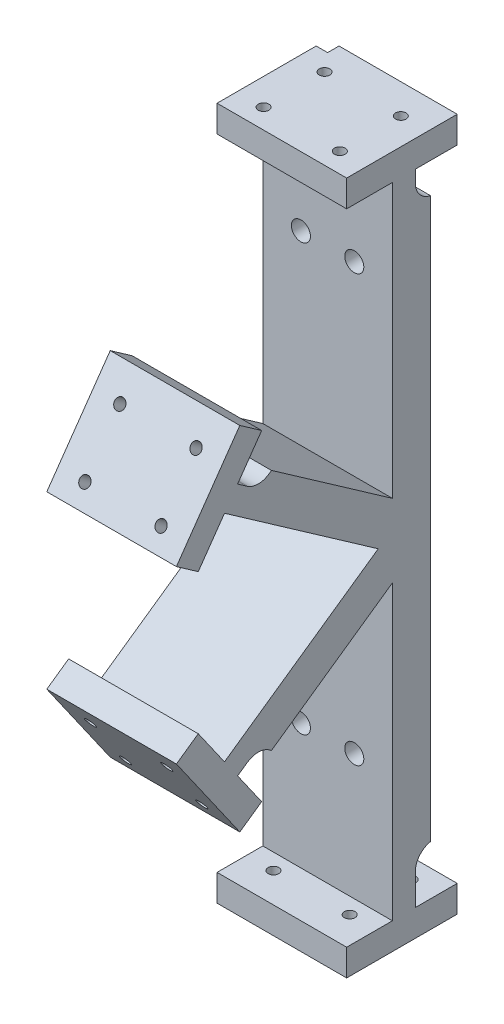
from build123d import *

# Parameters (mm, degrees)
SKETCH2_W           = 147.5
SKETCH2_H           = 176.75
BOSS_EXTRUDE1_DEPTH = 10
SKETCH3_W           = 29
SKETCH3_H           = 15
BOSS_EXTRUDE2_DEPTH = 34
BOSS_EXTRUDE3_DEPTH = 34
SKETCH8_W           = 113.5
SKETCH8_H           = 176.75
CUT_EXTRUDE1_DEPTH  = 30
SKETCH9_R           = 2.5
CUT_EXTRUDE2_DEPTH  = 134.016415209
SKETCH10_W          = 3
SKETCH10_H          = 3
CUT_EXTRUDE3_DEPTH  = 3
SKETCH11_R          = 1.4
CUT_EXTRUDE4_DEPTH  = 10
SKETCH12_R          = 1.4
CUT_EXTRUDE5_DEPTH  = 10
SKETCH13_R          = 1.4
CUT_EXTRUDE6_DEPTH  = 10
SKETCH14_R          = 1.4
CUT_EXTRUDE7_DEPTH  = 10
SKETCH15_W          = 11
SKETCH15_H          = 8
SKETCH15_W_2        = 12
CUT_EXTRUDE8_DEPTH  = 116.802867905
CUT_EXTRUDE9_DEPTH  = 116.802867905
FILLET1_R           = 5
BOSS_EXTRUDE4_START = 5
SKETCH17_W          = 34
SKETCH17_H          = 29
SKETCH17_R          = 1.4
BOSS_EXTRUDE4_DEPTH = 5
SKETCH18_W          = 11
SKETCH18_H          = 5
SKETCH18_W_2        = 12
CUT_EXTRUDE10_DEPTH = 120.662250585


with BuildPart() as part:
    # Sketch2 → Boss-Extrude1 (new body)
    with BuildSketch(Plane.XY):
        Rectangle(SKETCH2_W, SKETCH2_H)
    extrude(amount=BOSS_EXTRUDE1_DEPTH)

    # Sketch3 → Boss-Extrude2 (add)
    with BuildSketch(Plane.ZY.offset(73.75)):
        with Locations((7.5, 80.875)):
            Rectangle(SKETCH3_W, SKETCH3_H)
        with Locations((7.5, -80.875)):
            Rectangle(SKETCH3_W, SKETCH3_H)
    boss_extrude2 = extrude(amount=-BOSS_EXTRUDE2_DEPTH)

    # Mirror1: Boss-Extrude2 across plane
    add(boss_extrude2.mirror(Plane(origin=(0, 0, 0), x_dir=(0, 0, 1), z_dir=(1, 0, 0))))

    # Sketch5 → Boss-Extrude3 (add)
    with BuildSketch(Plane.ZY.offset(73.75)):
        Polygon((13.717233978, 0), (47.494362324, 23.650999887), (54.37727956, 13.821175356), (66.664560225, 22.424821901), (50.030843571, 46.180231185), (37.743562906, 37.57658464), (41.758597961, 31.84252033), (10, 9.604910635), (10, -9.604910635), (41.758597961, -31.84252033), (37.743562906, -37.57658464), (50.030843571, -46.180231185), (66.664560225, -22.424821901), (54.37727956, -13.821175356), (47.494362324, -23.650999887), align=None)
    extrude(amount=-BOSS_EXTRUDE3_DEPTH)

    # Sketch8 → Cut-Extrude1 (cut)
    with BuildSketch(Plane.XY.offset(22)):
        with Locations((17, 0)):
            Rectangle(SKETCH8_W, SKETCH8_H)
    extrude(amount=-CUT_EXTRUDE1_DEPTH, mode=Mode.SUBTRACT)

    # Sketch9 → Cut-Extrude2 (cut, through all)
    with BuildSketch(Plane(origin=(0, 0, 0), x_dir=(-1, 0, 0), z_dir=(0, 0, -1))):
        with Locations((49.75, 58.375)):
            Circle(SKETCH9_R)
        with Locations((63.75, 58.375)):
            Circle(SKETCH9_R)
        with Locations((49.75, -53.375)):
            Circle(SKETCH9_R)
        with Locations((63.75, -53.375)):
            Circle(SKETCH9_R)
    extrude(amount=-CUT_EXTRUDE2_DEPTH, mode=Mode.SUBTRACT)

    # Sketch10 → Cut-Extrude3 (cut)
    with BuildSketch(Plane(origin=(0, 0, -7), x_dir=(-1, 0, 0), z_dir=(0, 0, -1))):
        with Locations((72.25, 86.875)):
            Rectangle(SKETCH10_W, SKETCH10_H)
    extrude(amount=-CUT_EXTRUDE3_DEPTH, mode=Mode.SUBTRACT)

    # Sketch11 → Cut-Extrude4 (cut)
    with BuildSketch(Plane(origin=(0, 88.375, 0), x_dir=(1, 0, 0), z_dir=(0, 1, 0))):
        with Locations(Location((-46.75, -16.8, 0), (0, 0, 270))):
            Circle(SKETCH11_R)
        with Locations(Location((-66.75, -16.8, 0), (0, 0, 270))):
            Circle(SKETCH11_R)
        with Locations(Location((-66.75, -0.8, 0), (0, 0, 270))):
            Circle(SKETCH11_R)
        with Locations(Location((-46.75, -0.8, 0), (0, 0, 270))):
            Circle(SKETCH11_R)
    extrude(amount=-CUT_EXTRUDE4_DEPTH, mode=Mode.SUBTRACT)

    # Sketch12 → Cut-Extrude5 (cut)
    with BuildSketch(Plane.XZ.offset(88.375)):
        with Locations(Location((-46.75, -1.8, 0), (0, 0, 270))):
            Circle(SKETCH12_R)
        with Locations(Location((-66.75, -1.8, 0), (0, 0, 270))):
            Circle(SKETCH12_R)
        with Locations(Location((-66.75, 14.2, 0), (0, 0, 270))):
            Circle(SKETCH12_R)
        with Locations(Location((-46.75, 14.2, 0), (0, 0, 270))):
            Circle(SKETCH12_R)
    extrude(amount=-CUT_EXTRUDE5_DEPTH, mode=Mode.SUBTRACT)

    # Sketch13 → Cut-Extrude6 (cut)
    with BuildSketch(Plane(origin=(0, 38.699638206, 55.268811165), x_dir=(1, 0, 0), z_dir=(0, 0.5735764363510447, 0.8191520442889927))):
        with Locations(Location((-46.75, -14.667882182, 0), (0, 0, 270))):
            Circle(SKETCH13_R)
        with Locations(Location((-66.75, -14.667882182, 0), (0, 0, 270))):
            Circle(SKETCH13_R)
        with Locations(Location((-66.75, 1.332117818, 0), (0, 0, 270))):
            Circle(SKETCH13_R)
        with Locations(Location((-46.75, 1.332117818, 0), (0, 0, 270))):
            Circle(SKETCH13_R)
    extrude(amount=-CUT_EXTRUDE6_DEPTH, mode=Mode.SUBTRACT)

    # Sketch14 → Cut-Extrude7 (cut)
    with BuildSketch(Plane(origin=(0, -38.699638206, 55.268811165), x_dir=(1, 0, 0), z_dir=(0, -0.5735764363510447, 0.8191520442889929))):
        with Locations(Location((-46.75, -3.932117818, 0), (0, 0, 270))):
            Circle(SKETCH14_R)
        with Locations(Location((-66.75, -3.932117818, 0), (0, 0, 270))):
            Circle(SKETCH14_R)
        with Locations(Location((-66.75, 12.067882182, 0), (0, 0, 270))):
            Circle(SKETCH14_R)
        with Locations(Location((-46.75, 12.067882182, 0), (0, 0, 270))):
            Circle(SKETCH14_R)
    extrude(amount=-CUT_EXTRUDE7_DEPTH, mode=Mode.SUBTRACT)

    # Sketch15 → Cut-Extrude8 (cut, through all)
    with BuildSketch(Plane.ZY.offset(73.75)):
        with Locations((-1.5, 77.375)):
            Rectangle(SKETCH15_W, SKETCH15_H)
        with Locations((16, 77.375)):
            Rectangle(SKETCH15_W_2, SKETCH15_H)
        with Locations((16, -77.375)):
            Rectangle(SKETCH15_W_2, SKETCH15_H)
        with Locations((-1.5, -77.375)):
            Rectangle(SKETCH15_W, SKETCH15_H)
    extrude(amount=-CUT_EXTRUDE8_DEPTH, mode=Mode.SUBTRACT)

    # Sketch16 → Cut-Extrude9 (cut, through all)
    with BuildSketch(Plane.ZY.offset(73.75)):
        Polygon((37.743562906, 37.57658464), (41.758597961, 31.84252033), (44.052903706, 28.565912153), (50.60612006, 33.154523644), (44.296779261, 42.165196131), align=None)
        Polygon((54.047578679, 28.239611378), (47.494362324, 23.650999887), (54.37727956, 13.821175356), (60.930495915, 18.409786846), align=None)
        Polygon((47.494362324, -23.650999887), (54.047578679, -28.239611378), (60.930495915, -18.409786846), (54.37727956, -13.821175356), align=None)
        Polygon((37.743562906, -37.57658464), (44.296779261, -42.165196131), (50.60612006, -33.154523644), (44.052903706, -28.565912153), (41.758597961, -31.84252033), align=None)
    extrude(amount=-CUT_EXTRUDE9_DEPTH, mode=Mode.SUBTRACT)

    # Fillet1
    # the kernel refuses this fillet: 5 mm, written as the material it adds along each edge
    with BuildSketch(Plane(origin=(-73.75, -73.375, 4), x_dir=(0, -1, 0), z_dir=(1, 0, 0)), Plane(origin=(-73.75, -28.565912153, 44.052903706), x_dir=(0, -0.5735764363510428, 0.819152044288994), z_dir=(1, 0, 0))) as fillet1_piece_1:
        with BuildLine():
            CenterArc((4.898979486, 5), FILLET1_R, 191.536959033, 78.463040967)
            Line((0, 4), (-0.09797959, 3.98))
            ThreePointArc((-0.09797959, 3.98), (-0.1, 2), (-0.1, 0))
            Line((-0.1, 0), (0, -0.1))
            Line((0, -0.1), (4.898979486, -0.1))
            Line((4.898979486, -0.1), (4.898979486, 0))
        make_face()
    extrude(amount=34)
    with BuildSketch(Plane(origin=(-73.75, 28.565912153, 44.052903706), x_dir=(0, 0.8191520442898707, -0.5735764363497912), z_dir=(1, 0, 0))) as fillet1_piece_2:
        with BuildLine():
            CenterArc((5, 4.898979486), FILLET1_R, 180, 78.463040967)
            Line((0, 4.898979486), (-0.1, 4.898979486))
            Line((-0.1, 4.898979486), (-0.1, 0))
            Line((-0.1, 0), (0, -0.1))
            ThreePointArc((0, -0.1), (2, -0.1), (3.98, -0.09797959))
            Line((3.98, -0.09797959), (4, 0))
        make_face()
    extrude(amount=34)
    with BuildSketch(Plane(origin=(-73.75, 73.375, 4), x_dir=(0, 1, 0), z_dir=(1, 0, 0))) as fillet1_piece_3:
        with BuildLine():
            CenterArc((4.898979486, -5), FILLET1_R, 90, 78.463040967)
            Line((0, -4), (-0.09797959, -3.98))
            ThreePointArc((-0.09797959, -3.98), (-0.1, -2), (-0.1, 0))
            Line((-0.1, 0), (0, 0.1))
            Line((0, 0.1), (4.898979486, 0.1))
            Line((4.898979486, 0.1), (4.898979486, 0))
        make_face()
    extrude(amount=34)

    # Sketch17 → Boss-Extrude4 (add)
    with BuildSketch(Plane.XZ.offset(88.375).offset(BOSS_EXTRUDE4_START)):
        with Locations((-56.75, 7.5)):
            Rectangle(SKETCH17_W, SKETCH17_H)
        with Locations(Location((-66.75, 14.2, 0), (0, 0, 270))):
            Circle(SKETCH17_R, mode=Mode.SUBTRACT)
        with Locations(Location((-46.75, 14.2, 0), (0, 0, 270))):
            Circle(SKETCH17_R, mode=Mode.SUBTRACT)
        with Locations(Location((-46.75, -1.8, 0), (0, 0, 270))):
            Circle(SKETCH17_R, mode=Mode.SUBTRACT)
        with Locations(Location((-66.75, -1.8, 0), (0, 0, 270))):
            Circle(SKETCH17_R, mode=Mode.SUBTRACT)
    extrude(amount=-BOSS_EXTRUDE4_DEPTH)

    # Sketch18 → Cut-Extrude10 (cut, through all)
    with BuildSketch(Plane.ZY.offset(73.75)):
        with Locations((-1.5, -83.875)):
            Rectangle(SKETCH18_W, SKETCH18_H)
        with Locations((16, -83.875)):
            Rectangle(SKETCH18_W_2, SKETCH18_H)
    extrude(amount=-CUT_EXTRUDE10_DEPTH, mode=Mode.SUBTRACT)


solid = part.part
